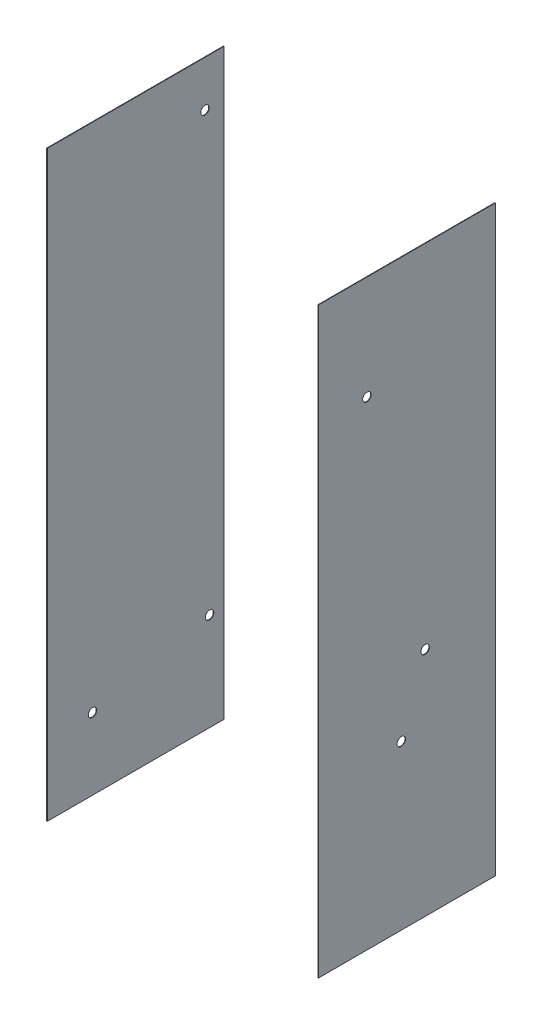
from build123d import *

# Parameters (mm, degrees)
BOSS_EXTRUDE1_OUTLINE_W = 596.9
BOSS_EXTRUDE1_OUTLINE_H = 1968.5
BOSS_EXTRUDE1_DEPTH     = 1.778
SKETCH3_R               = 14.2875
CUT_EXTRUDE1_DEPTH      = 2.54
CUT_EXTRUDE2_DEPTH      = 34.798
CUT_EXTRUDE2_DEPTH_BACK = 16.002
SKETCH4_R               = 14.2875


# Read off the part's stored shape, not the designer's step: Boss-Extrude1
with BuildPart() as part:
    # Boss-Extrude1 outline → Boss-Extrude1 (new body)
    with BuildSketch(Plane(origin=(457.2, 0, 0), x_dir=(0, 0, -1), z_dir=(1, 0, 0))):
        Rectangle(BOSS_EXTRUDE1_OUTLINE_W, BOSS_EXTRUDE1_OUTLINE_H)
    extrude(amount=BOSS_EXTRUDE1_DEPTH)


with BuildPart() as body_2:
    # Mirror7: mirrored copy
    add(part.part.mirror(Plane(origin=(0, 0, 0), x_dir=(0, 0, 1), z_dir=(1, 0, 0))))

    # Sketch4 → Cut-Extrude2 (cut, two sides: drawn at the far end of the back side and taken through both)
    with BuildSketch(Plane.ZY.offset(457.2).offset(-CUT_EXTRUDE2_DEPTH_BACK)):
        with Locations((-234.315, 829.522755889)):
            Circle(SKETCH4_R)
        with Locations((-249.6693, -654.637344111)):
            Circle(SKETCH4_R)
        with Locations((145.542, -742.267344111)):
            Circle(SKETCH4_R)
    extrude(amount=CUT_EXTRUDE2_DEPTH + CUT_EXTRUDE2_DEPTH_BACK, mode=Mode.SUBTRACT)


with BuildPart() as part_1:
    add(part.part)

    # Sketch3 → Cut-Extrude1 (cut)
    with BuildSketch(Plane(origin=(458.978, 0, 0), x_dir=(0, 0, -1), z_dir=(1, 0, 0))):
        with Locations((61.7093, -203.419044111)):
            Circle(SKETCH3_R)
        with Locations((-19.05, -432.196844111)):
            Circle(SKETCH3_R)
        with Locations((-135.025897323, 633.21184)):
            Circle(SKETCH3_R)
    extrude(amount=-CUT_EXTRUDE1_DEPTH, mode=Mode.SUBTRACT)


solid = Compound([body_2.part, part_1.part])
